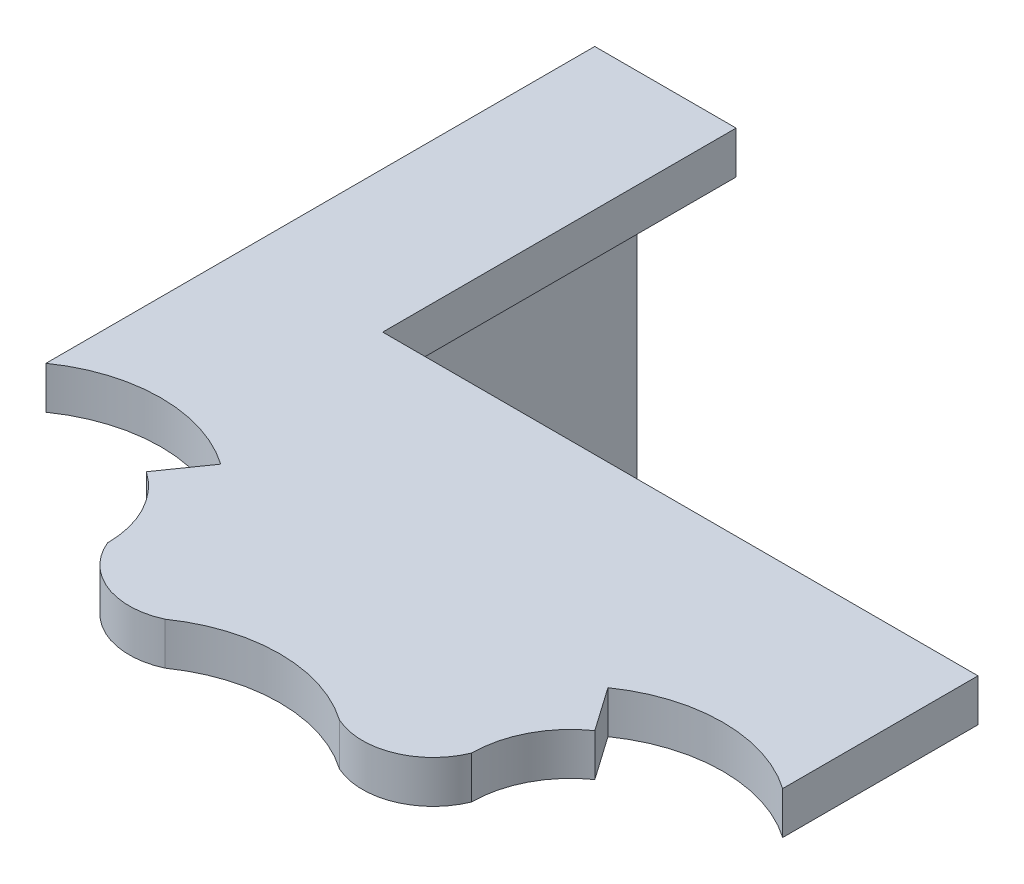
from build123d import *

# Parameters (mm, degrees)
BOSS_EXTRUDE1_DEPTH = 3
SKETCH3_W           = 3
SKETCH3_H           = 22.5
BOSS_EXTRUDE2_DEPTH = 25


with BuildPart() as part:
    # Sketch2 → Boss-Extrude1 (new body)
    with BuildSketch(Plane(origin=(0, 0, 0), x_dir=(1, 0, 0), z_dir=(0, 1, 0))):
        with BuildLine():
            Line((-15.860247962, 17.20906431), (-13.694996915, 20.301363277))
            ThreePointArc((-13.694996915, 20.301363277), (-19.875283017, 22.25), (-26.055569119, 20.301363277))
            Line((-26.055569119, 20.301363277), (-26.055569119, 34.118363277))
            Line((-26.055569119, 34.118363277), (-26.055569119, 59.118363277))
            Line((-26.055569119, 59.118363277), (-16.055569119, 59.118363277))
            Line((-16.055569119, 59.118363277), (-16.055569119, 34.118363277))
            Line((-16.055569119, 34.118363277), (26.055569119, 34.118363277))
            Line((26.055569119, 34.118363277), (26.055569119, 20.301363277))
            ThreePointArc((26.055569119, 20.301363277), (19.875283017, 22.25), (13.694996915, 20.301363277))
            Line((13.694996915, 20.301363277), (15.860247962, 17.20906431))
            ThreePointArc((15.860247962, 17.20906431), (13.666207185, 14.707240293), (12.875283017, 11.475))
            ThreePointArc((12.875283017, 11.475), (10.090653959, 8.727908609), (6.180286102, 8.826363277))
            ThreePointArc((6.180286102, 8.826363277), (0, 10.775), (-6.180286102, 8.826363277))
            ThreePointArc((-6.180286102, 8.826363277), (-10.090653959, 8.727908609), (-12.875283017, 11.475))
            ThreePointArc((-12.875283017, 11.475), (-13.666207185, 14.707240293), (-15.860247962, 17.20906431))
        make_face()
    extrude(amount=BOSS_EXTRUDE1_DEPTH)

    # Sketch3 → Boss-Extrude2 (add)
    with BuildSketch(Plane.XZ):
        with Locations((-24.555569119, -47.868363277)):
            Rectangle(SKETCH3_W, SKETCH3_H)
    extrude(amount=BOSS_EXTRUDE2_DEPTH)


solid = part.part
